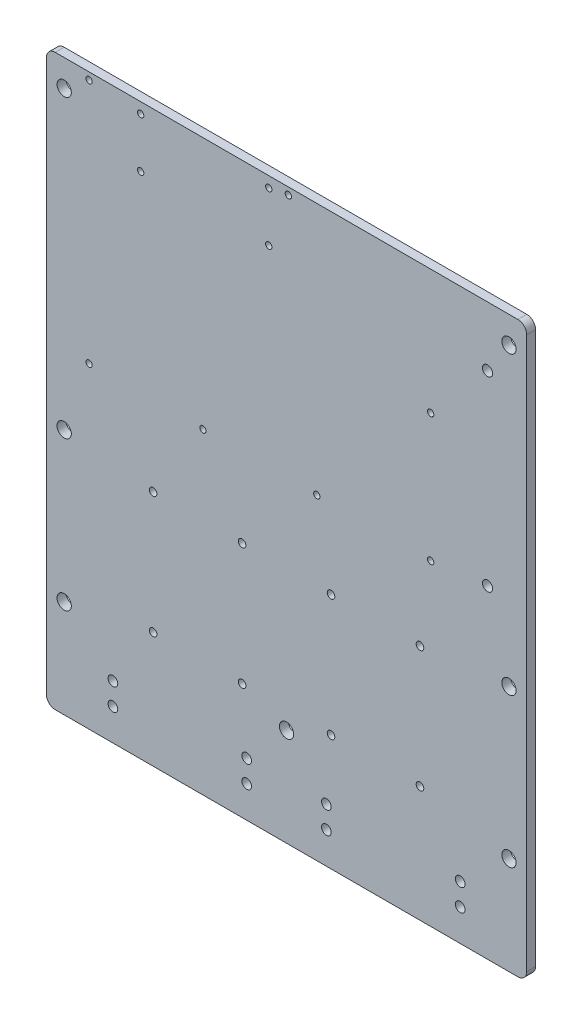
from build123d import *

# Parameters (mm, degrees)
SKETCH1_W              = 171.45
SKETCH1_H              = 203.2
BOSS_EXTRUDE1_DEPTH    = 3.175
F_10_CLEARANCE_HOLE1_D = 5.1054
F_6_32_TAPPED_HOLE1_D  = 2.7051
LPATTERN1_COUNT        = 4
LPATTERN1_PITCH        = 31.75
F_8_32_TAPPED_HOLE1_D  = 3.4544
M3_CLEARANCE_HOLE1_D   = 3.6
FILLET1_R              = 3.175
F_4_40_TAPPED_HOLE1_D  = 2.2606


with BuildPart() as part:
    # Sketch1 → Boss-Extrude1 (new body)
    with BuildSketch(Plane.XY):
        Rectangle(SKETCH1_W, SKETCH1_H)
    extrude(amount=BOSS_EXTRUDE1_DEPTH)

    # #10 Clearance Hole1 (through all)
    with Locations(Plane.XY.offset(3.175)):
        with Locations((-79.375, 92.075), (79.375, 92.075), (79.375, -66.675), (-79.375, -66.675), (-79.375, -13.462), (79.375, -13.462), (0, -66.675)):
            Hole(F_10_CLEARANCE_HOLE1_D / 2)

    # #6-32 Tapped Hole1 (through all)
    with Locations(Plane.XY.offset(3.175)):
        with Locations((-47.625, -60.2), (-47.625, -16.8)):
            f_6_32_tapped_hole1 = Hole(F_6_32_TAPPED_HOLE1_D / 2)

    # LPattern1: #6-32 Tapped Hole1 ×4
    with Locations(*[(i * LPATTERN1_PITCH, 0, 0) for i in range(1, LPATTERN1_COUNT)]):
        add(f_6_32_tapped_hole1, mode=Mode.SUBTRACT)

    # #8-32 Tapped Hole1 (through all)
    with Locations(Plane.XY.offset(3.175)):
        with Locations((-61.976, -82.423), (-61.976, -90.297), (-14.224, -82.423), (-14.224, -90.297)):
            f_8_32_tapped_hole1 = Hole(F_8_32_TAPPED_HOLE1_D / 2)

    # Mirror1: #8-32 Tapped Hole1 across plane
    add(f_8_32_tapped_hole1.mirror(Plane(origin=(0, 0, 0), x_dir=(0, 0, 1), z_dir=(1, 0, 0))), mode=Mode.SUBTRACT)

    # M3 Clearance Hole1 (through all)
    with Locations(Plane(origin=(0, 0, 0), x_dir=(-1, 0, 0), z_dir=(0, 0, -1))):
        with Locations((-71.725, 80.33377417), (-71.725, 13.83377417)):
            Hole(M3_CLEARANCE_HOLE1_D / 2)

    # Fillet1
    fillet1_edges = [part.edges().sort_by_distance(p)[0] for p in [
        (-85.725, -101.6, 1.5875),
        (-85.725, 101.6, 1.5875),
        (85.725, 101.6, 1.5875),
        (85.725, -101.6, 1.5875),
    ]]
    fillet(fillet1_edges, radius=FILLET1_R)

    # #4-40 Tapped Hole1 (through all)
    with Locations(Plane.XY.offset(3.175)):
        with Locations((-70.485, 99.06), (-52.07, 80.01), (-52.07, 97.79), (-6.35, 97.79), (0.635, 99.06), (-6.35, 80.01), (-70.485, 11.43), (-29.845, 11.43), (10.795, 11.43), (51.435, 11.43), (51.435, 57.15)):
            Hole(F_4_40_TAPPED_HOLE1_D / 2)


solid = part.part
